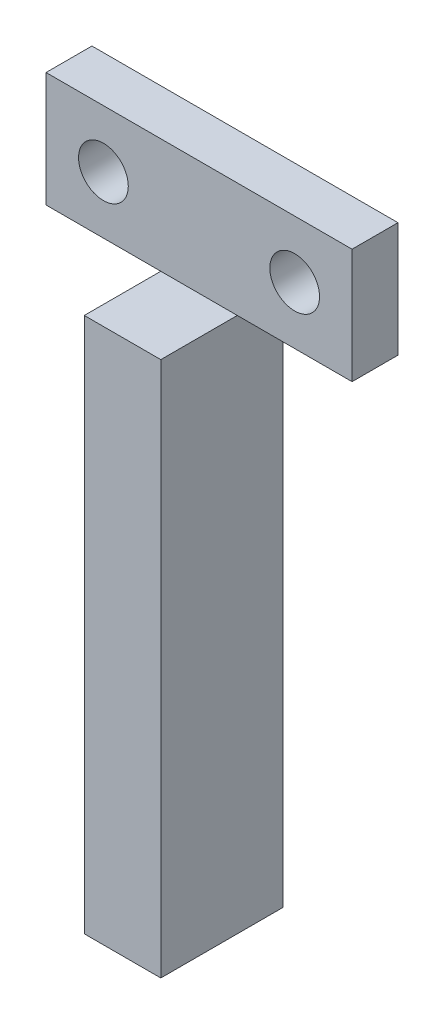
from build123d import *

# Parameters (mm, degrees)
SKETCH1_R           = 1.625
BOSS_EXTRUDE1_DEPTH = 3
SKETCH3_W           = 5
SKETCH3_H           = 35
BOSS_EXTRUDE3_DEPTH = 5


with BuildPart() as part:
    # Sketch1 → Boss-Extrude1 (new body)
    with BuildSketch(Plane.XY):
        Polygon((0, 0), (0, 35), (-7.5, 35), (-7.5, 42.5), (12.5, 42.5), (12.5, 35), (5, 35), (5, 0), align=None)
        with Locations((-3.75, 38.75)):
            Circle(SKETCH1_R, mode=Mode.SUBTRACT)
        with Locations((8.75, 38.75)):
            Circle(SKETCH1_R, mode=Mode.SUBTRACT)
    extrude(amount=BOSS_EXTRUDE1_DEPTH)

    # Sketch3 → Boss-Extrude3 (add)
    with BuildSketch(Plane.XY.offset(3)):
        with Locations((2.5, 17.5)):
            Rectangle(SKETCH3_W, SKETCH3_H)
    extrude(amount=BOSS_EXTRUDE3_DEPTH)


solid = part.part
